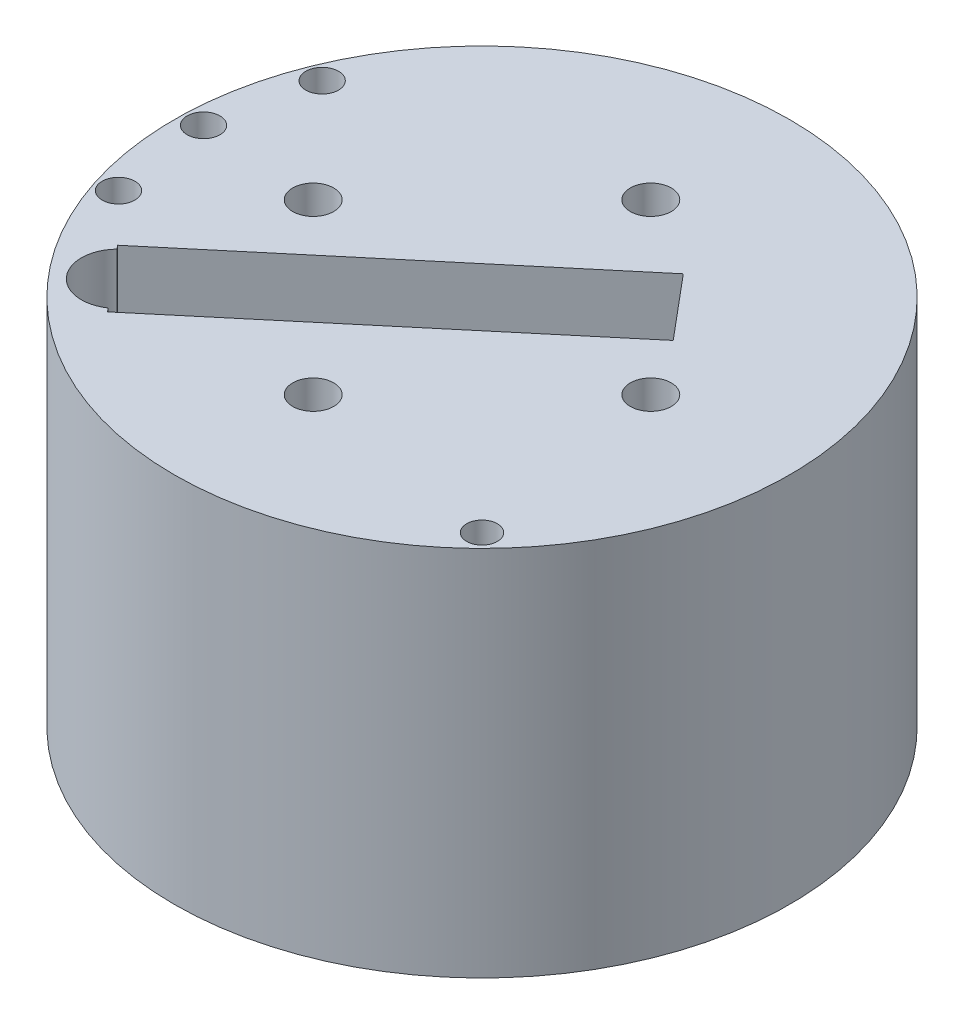
from build123d import *

# Parameters (mm, degrees)
SKETCH2_R           = 47.6885
BOSS_EXTRUDE1_DEPTH = 57.658
SKETCH5_R           = 2.54
SKETCH5_R_2         = 5.6388
CUT_EXTRUDE2_DEPTH  = 89.728975135
SKETCH4_R           = 3.175
CUT_EXTRUDE3_DEPTH  = 89.728975135
CUT_EXTRUDE4_DEPTH  = 43.18
SKETCH11_R          = 6.35
CUT_EXTRUDE7_DEPTH  = 7.62
SKETCH14_R          = 2.067000057
CUT_EXTRUDE8_DEPTH  = 19.05
SKETCH15_R          = 2.38125
CUT_EXTRUDE9_DEPTH  = 66.04


with BuildPart() as part:
    # Sketch2 → Boss-Extrude1 (new body)
    with BuildSketch(Plane(origin=(0, 0, 0), x_dir=(1, 0, 0), z_dir=(0, 1, 0))):
        Circle(SKETCH2_R)
    extrude(amount=BOSS_EXTRUDE1_DEPTH)

    # Sketch5 → Cut-Extrude2 (cut, through all)
    with BuildSketch(Plane(origin=(0, 57.658, 0), x_dir=(1, 0, 0), z_dir=(0, 1, 0))):
        with Locations((-41.445499463, 16.673368884)):
            Circle(SKETCH5_R)
        with Locations((-44.648658026, 1.492646038)):
            Circle(SKETCH5_R)
        with Locations((-42.466529486, -13.86811195)):
            Circle(SKETCH5_R)
        with Locations((-30.694251769, -25.755535339)):
            Circle(SKETCH5_R_2)
    extrude(amount=-CUT_EXTRUDE2_DEPTH, mode=Mode.SUBTRACT)

    # Sketch4 → Cut-Extrude3 (cut, through all)
    with BuildSketch(Plane(origin=(0, 57.658, 0), x_dir=(1, 0, 0), z_dir=(0, 1, 0))):
        with Locations((-26.162, 0)):
            Circle(SKETCH4_R)
        with Locations((26.162, 0)):
            Circle(SKETCH4_R)
        with Locations((0, 26.162)):
            Circle(SKETCH4_R)
        with Locations((0, -26.162)):
            Circle(SKETCH4_R)
    extrude(amount=-CUT_EXTRUDE3_DEPTH, mode=Mode.SUBTRACT)

    # Sketch6 → Cut-Extrude4 (cut)
    with BuildSketch(Plane(origin=(0, 57.658, 0), x_dir=(1, 0, 0), z_dir=(0, 1, 0))):
        Polygon((-27.050344847, -30.987270671), (20.620600848, 9.013402279), (12.457198205, 18.742166707), (-35.21374749, -21.258506244), align=None)
    extrude(amount=-CUT_EXTRUDE4_DEPTH, mode=Mode.SUBTRACT)

    # Sketch11 → Cut-Extrude7 (cut)
    with BuildSketch(Plane.XZ):
        with Locations((0, 26.162)):
            Circle(SKETCH11_R)
        with Locations((26.162, 0)):
            Circle(SKETCH11_R)
        with Locations((0, -26.162)):
            Circle(SKETCH11_R)
        with Locations((-26.162, 0)):
            Circle(SKETCH11_R)
    extrude(amount=-CUT_EXTRUDE7_DEPTH, mode=Mode.SUBTRACT)

    # Sketch14 → Cut-Extrude8 (cut)
    with BuildSketch(Plane.XZ):
        with Locations((1.356935186, -14.949033782)):
            Circle(SKETCH14_R)
        with Locations((4.523691953, 8.972265338)):
            Circle(SKETCH14_R)
    extrude(amount=-CUT_EXTRUDE8_DEPTH, mode=Mode.SUBTRACT)

    # Sketch15 → Cut-Extrude9 (cut)
    with BuildSketch(Plane.XZ):
        with Locations((31.589006405, 31.589006405)):
            Circle(SKETCH15_R)
    extrude(amount=-CUT_EXTRUDE9_DEPTH, mode=Mode.SUBTRACT)


solid = part.part
